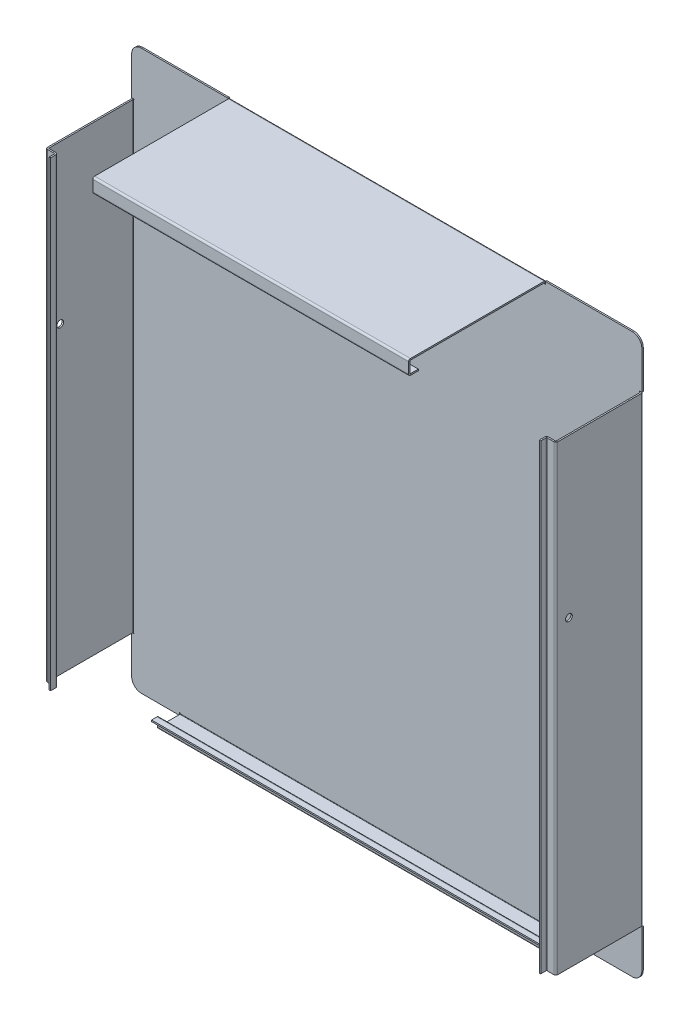
from build123d import *

# Parameters (mm, degrees)
SKETCH_2_W                          = 1050
SKETCH_2_H                          = 1150
SM_BASE_FLANGE_1_DEPTH              = 3
SM_EDGE_FLANGE_1_STRIP_W            = 13.4732
SM_EDGE_FLANGE_1_STRIP_H            = 3
SM_EDGE_FLANGE_1_STRIP_CUT_DEPTH    = 950
SM_EDGE_FLANGE_1_RELIEF_W           = 14.9732
SM_EDGE_FLANGE_1_RELIEF_H           = 1.5
SM_EDGE_FLANGE_1_RELIEF_CUT_DEPTH   = 3
SM_EDGE_FLANGE_1_STRIP_2_W          = 13.4732
SM_EDGE_FLANGE_1_STRIP_2_H          = 3
SM_EDGE_FLANGE_1_STRIP_CUT_2_DEPTH  = 950
SM_EDGE_FLANGE_1_RELIEF_2_W         = 14.9732
SM_EDGE_FLANGE_1_RELIEF_2_H         = 1.5
SM_EDGE_FLANGE_1_RELIEF_CUT_2_DEPTH = 3
SM_EDGE_FLANGE_1_DEPTH              = 950
SM_EDGE_FLANGE_1_BEND_DEPTH         = 950
SM_EDGE_FLANGE_4_STRIP_W            = 13.4732
SM_EDGE_FLANGE_4_STRIP_H            = 3
SM_EDGE_FLANGE_4_STRIP_CUT_DEPTH    = 850
SM_EDGE_FLANGE_4_RELIEF_W           = 14.9732
SM_EDGE_FLANGE_4_RELIEF_H           = 1.5
SM_EDGE_FLANGE_4_RELIEF_CUT_DEPTH   = 3
SM_EDGE_FLANGE_4_DEPTH              = 850
SM_EDGE_FLANGE_5_STRIP_W            = 13.4732
SM_EDGE_FLANGE_5_STRIP_H            = 3
SM_EDGE_FLANGE_5_STRIP_CUT_DEPTH    = 650
SM_EDGE_FLANGE_5_RELIEF_W           = 14.9732
SM_EDGE_FLANGE_5_RELIEF_H           = 1.5
SM_EDGE_FLANGE_5_RELIEF_CUT_DEPTH   = 3
SM_EDGE_FLANGE_5_DEPTH              = 650
SM_EDGE_FLANGE_2_STRIP_W            = 13.4732
SM_EDGE_FLANGE_2_STRIP_H            = 3
SM_EDGE_FLANGE_2_STRIP_CUT_DEPTH    = 950
SM_EDGE_FLANGE_2_STRIP_2_W          = 13.4732
SM_EDGE_FLANGE_2_STRIP_2_H          = 3
SM_EDGE_FLANGE_2_STRIP_CUT_2_DEPTH  = 950
SM_EDGE_FLANGE_2_STRIP_3_W          = 13.4732
SM_EDGE_FLANGE_2_STRIP_3_H          = 3
SM_EDGE_FLANGE_2_STRIP_CUT_3_DEPTH  = 850
SM_EDGE_FLANGE_2_DEPTH              = 950
SM_EDGE_FLANGE_2_BEND_DEPTH         = 950
SM_EDGE_FLANGE_2_BEND_2_DEPTH       = 850
SM_EDGE_FLANGE_3_STRIP_W            = 13.4732
SM_EDGE_FLANGE_3_STRIP_H            = 3
SM_EDGE_FLANGE_3_STRIP_CUT_DEPTH    = 950
SM_EDGE_FLANGE_3_STRIP_2_W          = 13.4732
SM_EDGE_FLANGE_3_STRIP_2_H          = 3
SM_EDGE_FLANGE_3_STRIP_CUT_2_DEPTH  = 950
SM_EDGE_FLANGE_3_STRIP_3_W          = 13.4732
SM_EDGE_FLANGE_3_STRIP_3_H          = 3
SM_EDGE_FLANGE_3_STRIP_CUT_3_DEPTH  = 850
SM_EDGE_FLANGE_3_DEPTH              = 950
SM_EDGE_FLANGE_3_BEND_DEPTH         = 950
SM_EDGE_FLANGE_3_BEND_2_DEPTH       = 850
FILLET_1_R                          = 20
SM_EDGE_FLANGE_6_STRIP_W            = 13.4732
SM_EDGE_FLANGE_6_STRIP_H            = 3
SM_EDGE_FLANGE_6_STRIP_CUT_DEPTH    = 650
SM_EDGE_FLANGE_6_DEPTH              = 650
SM_EDGE_FLANGE_7_STRIP_W            = 13.4732
SM_EDGE_FLANGE_7_STRIP_H            = 3
SM_EDGE_FLANGE_7_STRIP_CUT_DEPTH    = 650
SM_EDGE_FLANGE_7_DEPTH              = 650
SKETCH_60_R                         = 7
CUT_EXTRUDE_1_DEPTH                 = 1230.440929854


# Sheet-metal steps are written as plain solids
with BuildPart() as part:
    # Sketch 2 → 基体-法兰1 (new body)
    with BuildSketch(Plane.XY):
        Rectangle(SKETCH_2_W, SKETCH_2_H)
    extrude(amount=-SM_BASE_FLANGE_1_DEPTH)

    # 边线-法兰1 strip (across the edge) → 边线-法兰1 strip cut (cut)
    with BuildSketch(Plane(origin=(-525, 475, 0), x_dir=(1, 0, 0), z_dir=(0, -1, 0))):
        with Locations((-3, -1.5)):
            Rectangle(SM_EDGE_FLANGE_1_STRIP_W, SM_EDGE_FLANGE_1_STRIP_H)
    extrude(amount=SM_EDGE_FLANGE_1_STRIP_CUT_DEPTH, mode=Mode.SUBTRACT)

    # 边线-法兰1 relief (on the sheet) → 边线-法兰1 relief cut (cut)
    with BuildSketch(Plane(origin=(-521.2634, 475, 0), x_dir=(1, 0, 0), z_dir=(0, 0, 1))):
        with Locations((-5.9866, 0.75)):
            Rectangle(SM_EDGE_FLANGE_1_RELIEF_W, SM_EDGE_FLANGE_1_RELIEF_H)
        with Locations((-5.9866, -950.75)):
            Rectangle(SM_EDGE_FLANGE_1_RELIEF_W, SM_EDGE_FLANGE_1_RELIEF_H)
    extrude(amount=-SM_EDGE_FLANGE_1_RELIEF_CUT_DEPTH, mode=Mode.SUBTRACT)

    # 边线-法兰1 strip 2 (across the edge) → 边线-法兰1 strip cut 2 (cut)
    with BuildSketch(Plane(origin=(525, -475, 0), x_dir=(-1, 0, 0), z_dir=(0, 1, 0))):
        with Locations((-3, -1.5)):
            Rectangle(SM_EDGE_FLANGE_1_STRIP_2_W, SM_EDGE_FLANGE_1_STRIP_2_H)
    extrude(amount=SM_EDGE_FLANGE_1_STRIP_CUT_2_DEPTH, mode=Mode.SUBTRACT)

    # 边线-法兰1 relief 2 (on the sheet) → 边线-法兰1 relief cut 2 (cut)
    with BuildSketch(Plane(origin=(521.2634, -475, 0), x_dir=(-1, 0, 0), z_dir=(0, 0, 1))):
        with Locations((-5.9866, 0.75)):
            Rectangle(SM_EDGE_FLANGE_1_RELIEF_2_W, SM_EDGE_FLANGE_1_RELIEF_2_H)
        with Locations((-5.9866, -950.75)):
            Rectangle(SM_EDGE_FLANGE_1_RELIEF_2_W, SM_EDGE_FLANGE_1_RELIEF_2_H)
    extrude(amount=-SM_EDGE_FLANGE_1_RELIEF_CUT_2_DEPTH, mode=Mode.SUBTRACT)

    # 边线-法兰1 section (across the edge) → 边线-法兰1 (add)
    with BuildSketch(Plane(origin=(-525, 475, 0), x_dir=(1, 0, 0), z_dir=(0, -1, 0))):
        with BuildLine():
            Line((0, 0.7366), (0, 177))
            Line((0, 177), (3, 177))
            Line((3, 177), (3, 0.7366))
            ThreePointArc((3, 0.7366), (3.215745145, 0.215745145), (3.7366, 0))
            Line((3.7366, 0), (3.7366, -3))
            ThreePointArc((3.7366, -3), (1.094424801, -1.905575199), (0, 0.7366))
        make_face()
    extrude(amount=SM_EDGE_FLANGE_1_DEPTH)

    # 边线-法兰1 section 2 (across the edge) → 边线-法兰1 bend (add)
    with BuildSketch(Plane(origin=(525, -475, 0), x_dir=(-1, 0, 0), z_dir=(0, 1, 0))):
        with BuildLine():
            Line((0, 0.7366), (0, 177))
            Line((0, 177), (3, 177))
            Line((3, 177), (3, 0.7366))
            ThreePointArc((3, 0.7366), (3.215745145, 0.215745145), (3.7366, 0))
            Line((3.7366, 0), (3.7366, -3))
            ThreePointArc((3.7366, -3), (1.094424801, -1.905575199), (0, 0.7366))
        make_face()
    extrude(amount=SM_EDGE_FLANGE_1_BEND_DEPTH)

    # 边线-法兰4 strip (across the edge) → 边线-法兰4 strip cut (cut)
    with BuildSketch(Plane(origin=(-425, -575, 0), x_dir=(0, 1, 0), z_dir=(1, 0, 0))):
        with Locations((-3, -1.5)):
            Rectangle(SM_EDGE_FLANGE_4_STRIP_W, SM_EDGE_FLANGE_4_STRIP_H)
    extrude(amount=SM_EDGE_FLANGE_4_STRIP_CUT_DEPTH, mode=Mode.SUBTRACT)

    # 边线-法兰4 relief (on the sheet) → 边线-法兰4 relief cut (cut)
    with BuildSketch(Plane(origin=(-425, -571.2634, 0), x_dir=(0, 1, 0), z_dir=(0, 0, 1))):
        with Locations((-5.9866, 0.75)):
            Rectangle(SM_EDGE_FLANGE_4_RELIEF_W, SM_EDGE_FLANGE_4_RELIEF_H)
        with Locations((-5.9866, -850.75)):
            Rectangle(SM_EDGE_FLANGE_4_RELIEF_W, SM_EDGE_FLANGE_4_RELIEF_H)
    extrude(amount=-SM_EDGE_FLANGE_4_RELIEF_CUT_DEPTH, mode=Mode.SUBTRACT)

    # 边线-法兰4 section (across the edge) → 边线-法兰4 (add)
    with BuildSketch(Plane(origin=(-425, -575, 0), x_dir=(0, 1, 0), z_dir=(1, 0, 0))):
        with BuildLine():
            Line((0, 0.7366), (0, 47))
            Line((0, 47), (3, 47))
            Line((3, 47), (3, 0.7366))
            ThreePointArc((3, 0.7366), (3.215745145, 0.215745145), (3.7366, 0))
            Line((3.7366, 0), (3.7366, -3))
            ThreePointArc((3.7366, -3), (1.094424801, -1.905575199), (0, 0.7366))
        make_face()
    extrude(amount=SM_EDGE_FLANGE_4_DEPTH)

    # 边线-法兰5 strip (across the edge) → 边线-法兰5 strip cut (cut)
    with BuildSketch(Plane(origin=(325, 575, 0), x_dir=(0, -1, 0), z_dir=(-1, 0, 0))):
        with Locations((-3, -1.5)):
            Rectangle(SM_EDGE_FLANGE_5_STRIP_W, SM_EDGE_FLANGE_5_STRIP_H)
    extrude(amount=SM_EDGE_FLANGE_5_STRIP_CUT_DEPTH, mode=Mode.SUBTRACT)

    # 边线-法兰5 relief (on the sheet) → 边线-法兰5 relief cut (cut)
    with BuildSketch(Plane(origin=(325, 571.2634, 0), x_dir=(0, -1, 0), z_dir=(0, 0, 1))):
        with Locations((-5.9866, 0.75)):
            Rectangle(SM_EDGE_FLANGE_5_RELIEF_W, SM_EDGE_FLANGE_5_RELIEF_H)
        with Locations((-5.9866, -650.75)):
            Rectangle(SM_EDGE_FLANGE_5_RELIEF_W, SM_EDGE_FLANGE_5_RELIEF_H)
    extrude(amount=-SM_EDGE_FLANGE_5_RELIEF_CUT_DEPTH, mode=Mode.SUBTRACT)

    # 边线-法兰5 section (across the edge) → 边线-法兰5 (add)
    with BuildSketch(Plane(origin=(325, 575, 0), x_dir=(0, -1, 0), z_dir=(-1, 0, 0))):
        with BuildLine():
            Line((0, 0.7366), (0, 280))
            Line((0, 280), (3, 280))
            Line((3, 280), (3, 0.7366))
            ThreePointArc((3, 0.7366), (3.215745145, 0.215745145), (3.7366, 0))
            Line((3.7366, 0), (3.7366, -3))
            ThreePointArc((3.7366, -3), (1.094424801, -1.905575199), (0, 0.7366))
        make_face()
    extrude(amount=SM_EDGE_FLANGE_5_DEPTH)

    # 边线-法兰2 strip (across the edge) → 边线-法兰2 strip cut (cut)
    with BuildSketch(Plane(origin=(-522, 475, 177), x_dir=(0, 0, -1), z_dir=(0, -1, 0))):
        with Locations((-3, -1.5)):
            Rectangle(SM_EDGE_FLANGE_2_STRIP_W, SM_EDGE_FLANGE_2_STRIP_H)
    extrude(amount=SM_EDGE_FLANGE_2_STRIP_CUT_DEPTH, mode=Mode.SUBTRACT)

    # 边线-法兰2 strip 2 (across the edge) → 边线-法兰2 strip cut 2 (cut)
    with BuildSketch(Plane(origin=(522, -475, 177), x_dir=(0, 0, -1), z_dir=(0, 1, 0))):
        with Locations((-3, -1.5)):
            Rectangle(SM_EDGE_FLANGE_2_STRIP_2_W, SM_EDGE_FLANGE_2_STRIP_2_H)
    extrude(amount=SM_EDGE_FLANGE_2_STRIP_CUT_2_DEPTH, mode=Mode.SUBTRACT)

    # 边线-法兰2 strip 3 (across the edge) → 边线-法兰2 strip cut 3 (cut)
    with BuildSketch(Plane(origin=(-425, -572, 47), x_dir=(0, 0, -1), z_dir=(1, 0, 0))):
        with Locations((-3, -1.5)):
            Rectangle(SM_EDGE_FLANGE_2_STRIP_3_W, SM_EDGE_FLANGE_2_STRIP_3_H)
    extrude(amount=SM_EDGE_FLANGE_2_STRIP_CUT_3_DEPTH, mode=Mode.SUBTRACT)

    # 边线-法兰2 section (across the edge) → 边线-法兰2 (add)
    with BuildSketch(Plane(origin=(-522, 475, 177), x_dir=(0, 0, -1), z_dir=(0, -1, 0))):
        with BuildLine():
            Line((0, 0.7366), (0, 19))
            Line((0, 19), (3, 19))
            Line((3, 19), (3, 0.7366))
            ThreePointArc((3, 0.7366), (3.215745145, 0.215745145), (3.7366, 0))
            Line((3.7366, 0), (3.7366, -3))
            ThreePointArc((3.7366, -3), (1.094424801, -1.905575199), (0, 0.7366))
        make_face()
    extrude(amount=SM_EDGE_FLANGE_2_DEPTH)

    # 边线-法兰2 section 2 (across the edge) → 边线-法兰2 bend (add)
    with BuildSketch(Plane(origin=(522, -475, 177), x_dir=(0, 0, -1), z_dir=(0, 1, 0))):
        with BuildLine():
            Line((0, 0.7366), (0, 19))
            Line((0, 19), (3, 19))
            Line((3, 19), (3, 0.7366))
            ThreePointArc((3, 0.7366), (3.215745145, 0.215745145), (3.7366, 0))
            Line((3.7366, 0), (3.7366, -3))
            ThreePointArc((3.7366, -3), (1.094424801, -1.905575199), (0, 0.7366))
        make_face()
    extrude(amount=SM_EDGE_FLANGE_2_BEND_DEPTH)

    # 边线-法兰2 section 3 (across the edge) → 边线-法兰2 bend 2 (add)
    with BuildSketch(Plane(origin=(-425, -572, 47), x_dir=(0, 0, -1), z_dir=(1, 0, 0))):
        with BuildLine():
            Line((0, 0.7366), (0, 19))
            Line((0, 19), (3, 19))
            Line((3, 19), (3, 0.7366))
            ThreePointArc((3, 0.7366), (3.215745145, 0.215745145), (3.7366, 0))
            Line((3.7366, 0), (3.7366, -3))
            ThreePointArc((3.7366, -3), (1.094424801, -1.905575199), (0, 0.7366))
        make_face()
    extrude(amount=SM_EDGE_FLANGE_2_BEND_2_DEPTH)

    # 边线-法兰3 strip (across the edge) → 边线-法兰3 strip cut (cut)
    with BuildSketch(Plane(origin=(-503, -475, 177), x_dir=(-1, 0, 0), z_dir=(0, 1, 0))):
        with Locations((-3, -1.5)):
            Rectangle(SM_EDGE_FLANGE_3_STRIP_W, SM_EDGE_FLANGE_3_STRIP_H)
    extrude(amount=SM_EDGE_FLANGE_3_STRIP_CUT_DEPTH, mode=Mode.SUBTRACT)

    # 边线-法兰3 strip 2 (across the edge) → 边线-法兰3 strip cut 2 (cut)
    with BuildSketch(Plane(origin=(503, 475, 177), x_dir=(1, 0, 0), z_dir=(0, -1, 0))):
        with Locations((-3, -1.5)):
            Rectangle(SM_EDGE_FLANGE_3_STRIP_2_W, SM_EDGE_FLANGE_3_STRIP_2_H)
    extrude(amount=SM_EDGE_FLANGE_3_STRIP_CUT_2_DEPTH, mode=Mode.SUBTRACT)

    # 边线-法兰3 strip 3 (across the edge) → 边线-法兰3 strip cut 3 (cut)
    with BuildSketch(Plane(origin=(425, -553, 47), x_dir=(0, -1, 0), z_dir=(-1, 0, 0))):
        with Locations((-3, -1.5)):
            Rectangle(SM_EDGE_FLANGE_3_STRIP_3_W, SM_EDGE_FLANGE_3_STRIP_3_H)
    extrude(amount=SM_EDGE_FLANGE_3_STRIP_CUT_3_DEPTH, mode=Mode.SUBTRACT)

    # 边线-法兰3 section (across the edge) → 边线-法兰3 (add)
    with BuildSketch(Plane(origin=(-503, -475, 177), x_dir=(-1, 0, 0), z_dir=(0, 1, 0))):
        with BuildLine():
            Line((0, 0.7366), (0, 12))
            Line((0, 12), (3, 12))
            Line((3, 12), (3, 0.7366))
            ThreePointArc((3, 0.7366), (3.215745145, 0.215745145), (3.7366, 0))
            Line((3.7366, 0), (3.7366, -3))
            ThreePointArc((3.7366, -3), (1.094424801, -1.905575199), (0, 0.7366))
        make_face()
    extrude(amount=SM_EDGE_FLANGE_3_DEPTH)

    # 边线-法兰3 section 2 (across the edge) → 边线-法兰3 bend (add)
    with BuildSketch(Plane(origin=(503, 475, 177), x_dir=(1, 0, 0), z_dir=(0, -1, 0))):
        with BuildLine():
            Line((0, 0.7366), (0, 12))
            Line((0, 12), (3, 12))
            Line((3, 12), (3, 0.7366))
            ThreePointArc((3, 0.7366), (3.215745145, 0.215745145), (3.7366, 0))
            Line((3.7366, 0), (3.7366, -3))
            ThreePointArc((3.7366, -3), (1.094424801, -1.905575199), (0, 0.7366))
        make_face()
    extrude(amount=SM_EDGE_FLANGE_3_BEND_DEPTH)

    # 边线-法兰3 section 3 (across the edge) → 边线-法兰3 bend 2 (add)
    with BuildSketch(Plane(origin=(425, -553, 47), x_dir=(0, -1, 0), z_dir=(-1, 0, 0))):
        with BuildLine():
            Line((0, 0.7366), (0, 12))
            Line((0, 12), (3, 12))
            Line((3, 12), (3, 0.7366))
            ThreePointArc((3, 0.7366), (3.215745145, 0.215745145), (3.7366, 0))
            Line((3.7366, 0), (3.7366, -3))
            ThreePointArc((3.7366, -3), (1.094424801, -1.905575199), (0, 0.7366))
        make_face()
    extrude(amount=SM_EDGE_FLANGE_3_BEND_2_DEPTH)

    # 圆角1
    fillet_1_edges = [part.edges().sort_by_distance(p)[0] for p in [
        (525, -575, -1.5),
        (-525, -575, -1.5),
        (-525, 575, -1.5),
        (525, 575, -1.5),
    ]]
    fillet(fillet_1_edges, radius=FILLET_1_R)

    # 边线-法兰6 strip (across the edge) → 边线-法兰6 strip cut (cut)
    with BuildSketch(Plane(origin=(325, 572, 280), x_dir=(0, 0, -1), z_dir=(-1, 0, 0))):
        with Locations((-3, -1.5)):
            Rectangle(SM_EDGE_FLANGE_6_STRIP_W, SM_EDGE_FLANGE_6_STRIP_H)
    extrude(amount=SM_EDGE_FLANGE_6_STRIP_CUT_DEPTH, mode=Mode.SUBTRACT)

    # 边线-法兰6 section (across the edge) → 边线-法兰6 (add)
    with BuildSketch(Plane(origin=(325, 572, 280), x_dir=(0, 0, -1), z_dir=(-1, 0, 0))):
        with BuildLine():
            Line((0, 0.7366), (0, 27))
            Line((0, 27), (3, 27))
            Line((3, 27), (3, 0.7366))
            ThreePointArc((3, 0.7366), (3.215745145, 0.215745145), (3.7366, 0))
            Line((3.7366, 0), (3.7366, -3))
            ThreePointArc((3.7366, -3), (1.094424801, -1.905575199), (0, 0.7366))
        make_face()
    extrude(amount=SM_EDGE_FLANGE_6_DEPTH)

    # 边线-法兰7 strip (across the edge) → 边线-法兰7 strip cut (cut)
    with BuildSketch(Plane(origin=(325, 545, 277), x_dir=(0, 1, 0), z_dir=(-1, 0, 0))):
        with Locations((-3, -1.5)):
            Rectangle(SM_EDGE_FLANGE_7_STRIP_W, SM_EDGE_FLANGE_7_STRIP_H)
    extrude(amount=SM_EDGE_FLANGE_7_STRIP_CUT_DEPTH, mode=Mode.SUBTRACT)

    # 边线-法兰7 section (across the edge) → 边线-法兰7 (add)
    with BuildSketch(Plane(origin=(325, 545, 277), x_dir=(0, 1, 0), z_dir=(-1, 0, 0))):
        with BuildLine():
            Line((0, 0.7366), (0, 17))
            Line((0, 17), (3, 17))
            Line((3, 17), (3, 0.7366))
            ThreePointArc((3, 0.7366), (3.215745145, 0.215745145), (3.7366, 0))
            Line((3.7366, 0), (3.7366, -3))
            ThreePointArc((3.7366, -3), (1.094424801, -1.905575199), (0, 0.7366))
        make_face()
    extrude(amount=SM_EDGE_FLANGE_7_DEPTH)

    # 草图60 → 切除-拉伸1 (cut, through all)
    with BuildSketch(Plane.ZY.offset(525)):
        with Locations((150, 150)):
            Circle(SKETCH_60_R)
    extrude(amount=-CUT_EXTRUDE_1_DEPTH, mode=Mode.SUBTRACT)


solid = part.part
